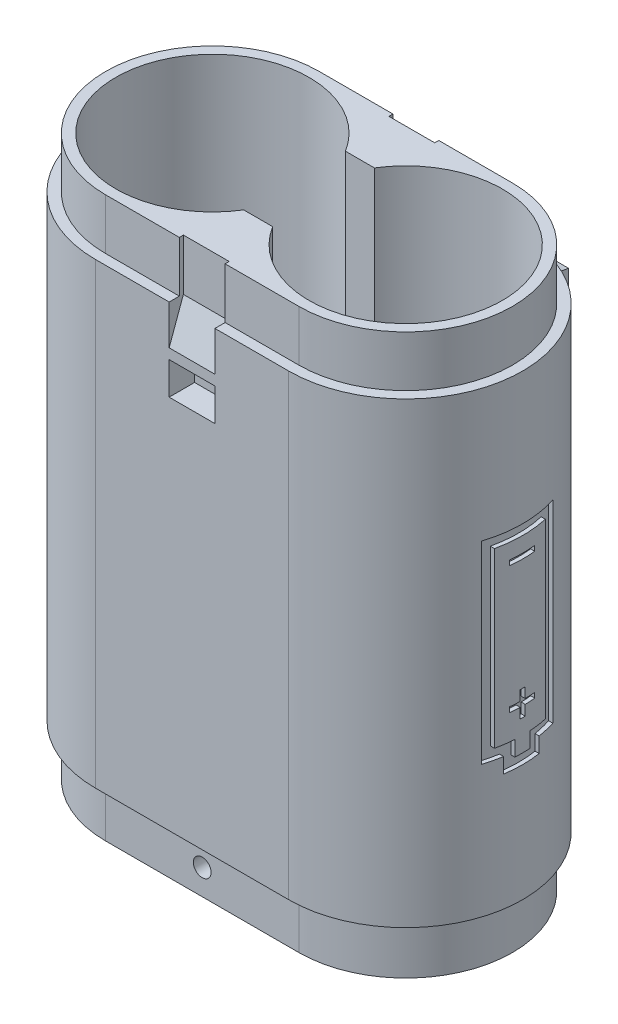
from build123d import *

# Parameters (mm, degrees)
BOSS_EXTRUDE1_DEPTH       = 55
BOSS_EXTRUDE2_START       = -50
BOSS_EXTRUDE2_DEPTH       = 45
SKETCH4_R                 = 0.875
CUT_EXTRUDE2_DEPTH        = 4
CUT_EXTRUDE3_START        = -17
SKETCH4_2_R               = 0.875
CUT_EXTRUDE3_DEPTH        = 4
SKETCH5_W                 = 3
SKETCH5_H                 = 35
BOSS_EXTRUDE3_DEPTH       = 4.5
SKETCH6_W                 = 2
SKETCH6_H                 = 30
CUT_EXTRUDE4_DEPTH        = 65.894144574
FILLET1_R                 = 5
FILLET2_START             = 9.396887596
FILLET2_DEPTH             = 3.103112404
FILLET2_START_2           = 42.5
FILLET2_2_DEPTH           = 3.103112404
FILLET2_START_3           = 5
FILLET2_3_DEPTH           = 4.643212907
FILLET2_START_4           = 45.356787093
FILLET2_4_DEPTH           = 4.643212907
FILLET2_START_5           = 5.025062714
FILLET2_5_DEPTH           = 4.371824882
FILLET2_START_6           = 45.603112404
FILLET2_6_DEPTH           = 4.371824782
FILLET2_START_7           = -12
FILLET2_7_DEPTH           = 24
CUT_EXTRUDE5_REACH        = 73.028
CUT_EXTRUDE5_END_RADIUS   = 11.1
SKETCH7_W                 = 2.5
SKETCH7_H                 = 0.5
CUT_EXTRUDE6_START        = 13.714909815
CUT_EXTRUDE6_DEPTH        = 19
CUT_EXTRUDE6_2_DEPTH      = 1.060507636
CUT_EXTRUDE6_START_2      = 31.775417451
CUT_EXTRUDE6_3_DEPTH      = 2.439492364
CUT_EXTRUDE6_4_DEPTH      = 0.939492364
CUT_EXTRUDE6_START_3      = 33.275417451
CUT_EXTRUDE6_5_DEPTH      = 0.939492364
CUT_EXTRUDE6_START_4      = 16.275417451
CUT_EXTRUDE6_6_DEPTH      = 0.5
CUT_EXTRUDE6_START_5      = 28.775417451
CUT_EXTRUDE6_7_DEPTH      = 0.5
CUT_EXTRUDE6_START_6      = 27.775417451
CUT_EXTRUDE6_8_DEPTH      = 2.5
SKETCH9_W                 = 4.5
SKETCH9_H                 = 3.2
CUT_EXTRUDE7_DEPTH        = 2.5
CUT_EXTRUDE8_START        = -23
SKETCH9_2_W               = 4.5
SKETCH9_2_H               = 3.2
CUT_EXTRUDE8_DEPTH        = 2.5
SKETCH10_W                = 4.5
SKETCH10_H                = 8.9
CUT_EXTRUDE9_DEPTH        = 1.4
CHAMFER1_SIZE2            = 3.846468387
CHAMFER1_SIZE             = 1.4
CHAMFER1_OF_MIRROR1_SIZE2 = 1.4
CHAMFER1_OF_MIRROR1_SIZE  = 3.846468387


with BuildPart() as part:
    # Sketch1 → Boss-Extrude1 (new body)
    with BuildSketch(Plane(origin=(0, 0, 0), x_dir=(1, 0, 0), z_dir=(0, 1, 0))):
        with BuildLine():
            Line((9.5, 10.5), (-9.5, 10.5))
            ThreePointArc((-9.5, 10.5), (-20, 0), (-9.5, -10.5))
            Line((-9.5, -10.5), (9.5, -10.5))
            ThreePointArc((9.5, -10.5), (20, 0), (9.5, 10.5))
        make_face()
        with BuildLine():
            Line((-1.422252789, 5), (1.422252789, 5))
            ThreePointArc((1.422252789, 5), (19, 0), (1.422252789, -5))
            Line((1.422252789, -5), (-1.422252789, -5))
            ThreePointArc((-1.422252789, -5), (-19, 0), (-1.422252789, 5))
        make_face(mode=Mode.SUBTRACT)
    extrude(amount=BOSS_EXTRUDE1_DEPTH)

    # Sketch2 → Boss-Extrude2 (add)
    with BuildSketch(Plane(origin=(0, 55, 0), x_dir=(1, 0, 0), z_dir=(0, 1, 0)).offset(BOSS_EXTRUDE2_START)):
        with BuildLine():
            Line((9.5, 11.5), (-9.5, 11.5))
            ThreePointArc((-9.5, 11.5), (-21, 0), (-9.5, -11.5))
            Line((-9.5, -11.5), (9.5, -11.5))
            ThreePointArc((9.5, -11.5), (21, 0), (9.5, 11.5))
        make_face()
        with BuildLine():
            Line((9.5, 10.5), (-9.5, 10.5))
            ThreePointArc((-9.5, 10.5), (-20, 0), (-9.5, -10.5))
            Line((-9.5, -10.5), (9.5, -10.5))
            ThreePointArc((9.5, -10.5), (20, 0), (9.5, 10.5))
        make_face(mode=Mode.SUBTRACT)
    extrude(amount=BOSS_EXTRUDE2_DEPTH)

    # Sketch4 → Cut-Extrude2 (cut)
    with BuildSketch(Plane(origin=(0, 0, -10.5), x_dir=(-1, 0, 0), z_dir=(0, 0, -1))):
        with Locations((0, 2.5)):
            Circle(SKETCH4_R)
    extrude(amount=-CUT_EXTRUDE2_DEPTH, mode=Mode.SUBTRACT)

    # Sketch4<2> → Cut-Extrude3 (cut)
    with BuildSketch(Plane(origin=(0, 0, -10.5), x_dir=(-1, 0, 0), z_dir=(0, 0, -1)).offset(CUT_EXTRUDE3_START)):
        with Locations((0, 2.5)):
            Circle(SKETCH4_2_R)
    extrude(amount=-CUT_EXTRUDE3_DEPTH, mode=Mode.SUBTRACT)

    # Sketch5 → Boss-Extrude3 (add)
    with BuildSketch(Plane(origin=(0, 0, -11.5), x_dir=(-1, 0, 0), z_dir=(0, 0, -1))):
        with Locations((-8, 27.5)):
            Rectangle(SKETCH5_W, SKETCH5_H)
        with Locations((8, 27.5)):
            Rectangle(SKETCH5_W, SKETCH5_H)
    extrude(amount=BOSS_EXTRUDE3_DEPTH)

    # Sketch6 → Cut-Extrude4 (cut, through all)
    with BuildSketch(Plane(origin=(9.5, 0, 0), x_dir=(0, 0, -1), z_dir=(1, 0, 0))):
        with Locations((12.5, 27.5)):
            Rectangle(SKETCH6_W, SKETCH6_H)
    extrude(amount=-CUT_EXTRUDE4_DEPTH, mode=Mode.SUBTRACT)

    # Fillet1
    # the kernel refuses this fillet: 5 mm, written as the material it adds along each edge
    with BuildSketch(Plane(origin=(9.5, 45, -11.5), x_dir=(0, 1, 0), z_dir=(-1, 0, 0)), Plane(origin=(6.5, 10, -11.5), x_dir=(0, -1, 0), z_dir=(1, 0, 0))) as fillet1_piece_1:
        with BuildLine():
            CenterArc((4.974937186, 5), FILLET1_R, 185.739170477, 84.260829523)
            Line((0, 4.5), (-0.099498744, 4.49))
            ThreePointArc((-0.099498744, 4.49), (-0.1, 2.25), (-0.1, 0))
            Line((-0.1, 0), (0, -0.1))
            Line((0, -0.1), (4.974937186, -0.1))
            Line((4.974937186, -0.1), (4.974937186, 0))
        make_face()
    extrude(amount=3)
    with BuildSketch(Plane(origin=(-9.5, 45, -11.5), x_dir=(0, 1, 0), z_dir=(1, 0, 0)), Plane(origin=(-6.5, 10, -11.5), x_dir=(0, -1, 0), z_dir=(-1, 0, 0))) as fillet1_piece_2:
        with BuildLine():
            CenterArc((4.974937186, -5), FILLET1_R, 90, 84.260829523)
            Line((0, -4.5), (-0.099498744, -4.49))
            ThreePointArc((-0.099498744, -4.49), (-0.1, -2.25), (-0.1, 0))
            Line((-0.1, 0), (0, 0.1))
            Line((0, 0.1), (4.974937186, 0.1))
            Line((4.974937186, 0.1), (4.974937186, 0))
        make_face()
    extrude(amount=3)

    # Fillet2: read off the stored shape, not the designer's step
    # Fillet2 outline → Fillet2 (add)
    with BuildSketch(Plane(origin=(0, 0, 0), x_dir=(1, 0, 0), z_dir=(0, 1, 0)).offset(FILLET2_START)):
        with BuildLine():
            Line((9.5, 13.351029923), (9.5, 11.5))
            ThreePointArc((9.5, 11.5), (10.354211629, 11.46823101), (11.203703704, 11.373099564))
            ThreePointArc((11.203703704, 11.373099564), (9.984646478, 12.045769909), (9.5, 13.351029923))
        make_face()
        with BuildLine():
            ThreePointArc((-11.203703704, 11.373099564), (-10.354211629, 11.46823101), (-9.5, 11.5))
            Line((-9.5, 11.5), (-9.5, 13.351029923))
            ThreePointArc((-9.5, 13.351029923), (-9.984646478, 12.045769909), (-11.203703704, 11.373099564))
        make_face()
    extrude(amount=FILLET2_DEPTH)

    # Fillet2 2 outline → Fillet2 2 (add)
    with BuildSketch(Plane(origin=(0, 0, 0), x_dir=(1, 0, 0), z_dir=(0, 1, 0)).offset(FILLET2_START_2)):
        with BuildLine():
            Line((9.5, 13.351029923), (9.5, 11.5))
            ThreePointArc((9.5, 11.5), (10.354211629, 11.46823101), (11.203703704, 11.373099564))
            ThreePointArc((11.203703704, 11.373099564), (9.984646478, 12.045769909), (9.5, 13.351029923))
        make_face()
        with BuildLine():
            ThreePointArc((-11.203703704, 11.373099564), (-10.354211629, 11.46823101), (-9.5, 11.5))
            Line((-9.5, 11.5), (-9.5, 13.351029923))
            ThreePointArc((-9.5, 13.351029923), (-9.984646478, 12.045769909), (-11.203703704, 11.373099564))
        make_face()
    extrude(amount=FILLET2_2_DEPTH)

    # Fillet2 3 outline → Fillet2 3 (add)
    with BuildSketch(Plane(origin=(0, 0, 0), x_dir=(1, 0, 0), z_dir=(0, 1, 0)).offset(FILLET2_START_3)):
        with BuildLine():
            Line((10.742577908, 11.5), (9.5, 11.5))
            ThreePointArc((9.5, 11.5), (10.354211629, 11.46823101), (11.203703704, 11.373099564))
            ThreePointArc((11.203703704, 11.373099564), (10.969333871, 11.422716292), (10.742577908, 11.5))
        make_face()
        with BuildLine():
            ThreePointArc((-10.742577908, 11.5), (-10.969333871, 11.422716292), (-11.203703704, 11.373099564))
            ThreePointArc((-11.203703704, 11.373099564), (-10.354211629, 11.46823101), (-9.5, 11.5))
            Line((-9.5, 11.5), (-10.742577908, 11.5))
        make_face()
    extrude(amount=FILLET2_3_DEPTH)

    # Fillet2 4 outline → Fillet2 4 (add)
    with BuildSketch(Plane(origin=(0, 0, 0), x_dir=(1, 0, 0), z_dir=(0, 1, 0)).offset(FILLET2_START_4)):
        with BuildLine():
            Line((10.742577908, 11.5), (9.5, 11.5))
            ThreePointArc((9.5, 11.5), (10.354211629, 11.46823101), (11.203703704, 11.373099564))
            ThreePointArc((11.203703704, 11.373099564), (10.969333871, 11.422716292), (10.742577908, 11.5))
        make_face()
        with BuildLine():
            ThreePointArc((-10.742577908, 11.5), (-10.969333871, 11.422716292), (-11.203703704, 11.373099564))
            ThreePointArc((-11.203703704, 11.373099564), (-10.354211629, 11.46823101), (-9.5, 11.5))
            Line((-9.5, 11.5), (-10.742577908, 11.5))
        make_face()
    extrude(amount=FILLET2_4_DEPTH)

    # Fillet2 5 outline → Fillet2 5 (add)
    with BuildSketch(Plane(origin=(0, 0, 0), x_dir=(1, 0, 0), z_dir=(0, 1, 0)).offset(FILLET2_START_5)):
        with BuildLine():
            Line((9.5, 13.351029923), (9.5, 11.5))
            Line((9.5, 11.5), (10.742577908, 11.5))
            ThreePointArc((10.742577908, 11.5), (9.839451268, 12.236320136), (9.5, 13.351029923))
        make_face()
        with BuildLine():
            ThreePointArc((-9.5, 13.351029923), (-9.839451268, 12.236320136), (-10.742577908, 11.5))
            Line((-10.742577908, 11.5), (-9.5, 11.5))
            Line((-9.5, 11.5), (-9.5, 13.351029923))
        make_face()
    extrude(amount=FILLET2_5_DEPTH)

    # Fillet2 6 outline → Fillet2 6 (add)
    with BuildSketch(Plane(origin=(0, 0, 0), x_dir=(1, 0, 0), z_dir=(0, 1, 0)).offset(FILLET2_START_6)):
        with BuildLine():
            Line((9.5, 13.351029923), (9.5, 11.5))
            Line((9.5, 11.5), (10.742577908, 11.5))
            ThreePointArc((10.742577908, 11.5), (9.839451268, 12.236320136), (9.5, 13.351029923))
        make_face()
        with BuildLine():
            ThreePointArc((-9.5, 13.351029923), (-9.839451268, 12.236320136), (-10.742577908, 11.5))
            Line((-10.742577908, 11.5), (-9.5, 11.5))
            Line((-9.5, 11.5), (-9.5, 13.351029923))
        make_face()
    extrude(amount=FILLET2_6_DEPTH)

    # Fillet2 7 outline → Fillet2 7 (cut)
    with BuildSketch(Plane.YZ.offset(FILLET2_START_7)):
        with BuildLine():
            ThreePointArc((49.974937186, -11.5), (47.823757321, -11.986417698), (46.091126241, -13.351029923))
            Line((46.091126241, -13.351029923), (49.974937186, -13.351029923))
            Line((49.974937186, -13.351029923), (49.974937186, -11.5))
        make_face()
        with BuildLine():
            Line((5.025062814, -11.5), (5.025062714, -13.351029923))
            Line((5.025062714, -13.351029923), (8.908873759, -13.351029923))
            ThreePointArc((8.908873759, -13.351029923), (7.176242679, -11.986417698), (5.025062814, -11.5))
        make_face()
    extrude(amount=FILLET2_7_DEPTH, mode=Mode.SUBTRACT)

    # Cut-Extrude5: up to this cylinder (the profile starts outside it)
    cut_extrude5_end = Plane(origin=(9.5, 25.483311, 0), z_dir=(0, 1, 0)) * Cylinder(CUT_EXTRUDE5_END_RADIUS, 186.789378, mode=Mode.PRIVATE)
    # Sketch7 → Cut-Extrude5 (cut, up to the surface)
    with BuildSketch(Plane(origin=(21, 0, 0), x_dir=(0, 0, -1), z_dir=(1, 0, 0)), mode=Mode.PRIVATE) as cut_extrude5_sk1:
        Polygon((-1.75, 16.5), (1.75, 16.5), (1.75, 18), (3.5, 18), (3.5, 37), (-3.5, 37), (-3.5, 18), (-1.75, 18), align=None)
        Polygon((0.75, 19), (2.5, 19), (2.5, 36), (-2.5, 36), (-2.5, 19), (-0.75, 19), (-0.75, 17.5), (0.75, 17.5), align=None, mode=Mode.SUBTRACT)
    cut_extrude5_tool1 = extrude(cut_extrude5_sk1.sketch, amount=-CUT_EXTRUDE5_REACH, mode=Mode.PRIVATE) - cut_extrude5_end
    add(cut_extrude5_tool1.solids().sort_by_distance((21, 16.716622, 0))[0], mode=Mode.SUBTRACT)
    # Sketch7 → Cut-Extrude5 (cut, up to the surface)
    with BuildSketch(Plane(origin=(21, 0, 0), x_dir=(0, 0, -1), z_dir=(1, 0, 0)), mode=Mode.PRIVATE) as cut_extrude5_sk2:
        Polygon((-0.25, 21.5), (-1.25, 21.5), (-1.25, 22), (-0.25, 22), (-0.25, 23), (0.25, 23), (0.25, 22), (1.25, 22), (1.25, 21.5), (0.25, 21.5), (0.25, 20.5), (-0.25, 20.5), align=None)
    cut_extrude5_tool2 = extrude(cut_extrude5_sk2.sketch, amount=-CUT_EXTRUDE5_REACH, mode=Mode.PRIVATE) - cut_extrude5_end
    add(cut_extrude5_tool2.solids().sort_by_distance((21, 21.75, 0))[0], mode=Mode.SUBTRACT)
    # Sketch7 → Cut-Extrude5 (cut, up to the surface)
    with BuildSketch(Plane(origin=(21, 0, 0), x_dir=(0, 0, -1), z_dir=(1, 0, 0)), mode=Mode.PRIVATE) as cut_extrude5_sk3:
        with Locations((0, 34.25)):
            Rectangle(SKETCH7_W, SKETCH7_H)
    cut_extrude5_tool3 = extrude(cut_extrude5_sk3.sketch, amount=-CUT_EXTRUDE5_REACH, mode=Mode.PRIVATE) - cut_extrude5_end
    add(cut_extrude5_tool3.solids().sort_by_distance((21, 34.25, 0))[0], mode=Mode.SUBTRACT)

    # Cut-Extrude6: read off the stored shape, not the designer's step
    # Cut-Extrude6 outline → Cut-Extrude6 (cut)
    with BuildSketch(Plane(origin=(0, 0, 0), x_dir=(1, 0, 0), z_dir=(0, 1, 0)).offset(CUT_EXTRUDE6_START)):
        with BuildLine():
            Line((-20.314804668, -2.5), (-20.72497216, -2.5))
            ThreePointArc((-20.72497216, -2.5), (-20.600977641, -3.003047686), (-20.45445115, -3.5))
            Line((-20.45445115, -3.5), (-20.033755266, -3.5))
            ThreePointArc((-20.033755266, -3.5), (-20.185983942, -3.003289395), (-20.314804668, -2.5))
        make_face()
        with BuildLine():
            ThreePointArc((-20.45445115, 3.5), (-20.600977641, 3.003047686), (-20.72497216, 2.5))
            Line((-20.72497216, 2.5), (-20.314804668, 2.5))
            ThreePointArc((-20.314804668, 2.5), (-20.185983942, 3.003289395), (-20.033755266, 3.5))
            Line((-20.033755266, 3.5), (-20.45445115, 3.5))
        make_face()
    extrude(amount=CUT_EXTRUDE6_DEPTH, mode=Mode.SUBTRACT)

    # Cut-Extrude6 2 outline → Cut-Extrude6 2 (cut)
    with BuildSketch(Plane(origin=(0, 0, 0), x_dir=(1, 0, 0), z_dir=(0, 1, 0)).offset(CUT_EXTRUDE6_START)):
        with BuildLine():
            Line((-20.72497216, -2.5), (-20.314804668, -2.5))
            ThreePointArc((-20.314804668, -2.5), (-20.6, 0), (-20.314804668, 2.5))
            Line((-20.314804668, 2.5), (-20.72497216, 2.5))
            ThreePointArc((-20.72497216, 2.5), (-21, 0), (-20.72497216, -2.5))
        make_face()
    extrude(amount=CUT_EXTRUDE6_2_DEPTH, mode=Mode.SUBTRACT)

    # Cut-Extrude6 3 outline → Cut-Extrude6 3 (cut)
    with BuildSketch(Plane(origin=(0, 0, 0), x_dir=(1, 0, 0), z_dir=(0, 1, 0)).offset(CUT_EXTRUDE6_START_2)):
        with BuildLine():
            Line((-20.866067922, -1.75), (-20.461181506, -1.75))
            ThreePointArc((-20.461181506, -1.75), (-20.529246673, -1.251286466), (-20.574633177, -0.75))
            Line((-20.574633177, -0.75), (-20.975517418, -0.75))
            ThreePointArc((-20.975517418, -0.75), (-20.93173238, -1.251197346), (-20.866067922, -1.75))
        make_face()
        with BuildLine():
            Line((-20.975517418, 0.75), (-20.574633177, 0.75))
            ThreePointArc((-20.574633177, 0.75), (-20.529246673, 1.251286466), (-20.461181506, 1.75))
            Line((-20.461181506, 1.75), (-20.866067922, 1.75))
            ThreePointArc((-20.866067922, 1.75), (-20.93173238, 1.251197346), (-20.975517418, 0.75))
        make_face()
    extrude(amount=CUT_EXTRUDE6_3_DEPTH, mode=Mode.SUBTRACT)

    # Cut-Extrude6 4 outline → Cut-Extrude6 4 (cut)
    with BuildSketch(Plane(origin=(0, 0, 0), x_dir=(1, 0, 0), z_dir=(0, 1, 0)).offset(CUT_EXTRUDE6_START_2)):
        with BuildLine():
            Line((-20.461181506, -1.75), (-20.866067922, -1.75))
            ThreePointArc((-20.866067922, -1.75), (-20.80174314, -2.126170737), (-20.72497216, -2.5))
            Line((-20.72497216, -2.5), (-20.314804668, -2.5))
            ThreePointArc((-20.314804668, -2.5), (-20.394448974, -2.12625999), (-20.461181506, -1.75))
        make_face()
        with BuildLine():
            ThreePointArc((-20.72497216, 2.5), (-20.80174314, 2.126170737), (-20.866067922, 1.75))
            Line((-20.866067922, 1.75), (-20.461181506, 1.75))
            ThreePointArc((-20.461181506, 1.75), (-20.394448974, 2.12625999), (-20.314804668, 2.5))
            Line((-20.314804668, 2.5), (-20.72497216, 2.5))
        make_face()
    extrude(amount=CUT_EXTRUDE6_4_DEPTH, mode=Mode.SUBTRACT)

    # Cut-Extrude6 5 outline → Cut-Extrude6 5 (cut)
    with BuildSketch(Plane(origin=(0, 0, 0), x_dir=(1, 0, 0), z_dir=(0, 1, 0)).offset(CUT_EXTRUDE6_START_3)):
        with BuildLine():
            Line((-20.975517418, -0.75), (-20.574633177, -0.75))
            ThreePointArc((-20.574633177, -0.75), (-20.6, 0), (-20.574633177, 0.75))
            Line((-20.574633177, 0.75), (-20.975517418, 0.75))
            ThreePointArc((-20.975517418, 0.75), (-21, 0), (-20.975517418, -0.75))
        make_face()
    extrude(amount=CUT_EXTRUDE6_5_DEPTH, mode=Mode.SUBTRACT)

    # Cut-Extrude6 6 outline → Cut-Extrude6 6 (cut)
    with BuildSketch(Plane(origin=(0, 0, 0), x_dir=(1, 0, 0), z_dir=(0, 1, 0)).offset(CUT_EXTRUDE6_START_4)):
        with BuildLine():
            Line((-20.914098741, -1.402978946), (-20.510978616, -1.402978946))
            ThreePointArc((-20.510978616, -1.402978946), (-20.598932236, -0.15395847), (-20.545657283, 1.097021054))
            Line((-20.545657283, 1.097021054), (-20.947556281, 1.097021054))
            ThreePointArc((-20.947556281, 1.097021054), (-20.998970284, -0.153890902), (-20.914098741, -1.402978946))
        make_face()
    extrude(amount=CUT_EXTRUDE6_6_DEPTH, mode=Mode.SUBTRACT)

    # Cut-Extrude6 7 outline → Cut-Extrude6 7 (cut)
    with BuildSketch(Plane(origin=(0, 0, 0), x_dir=(1, 0, 0), z_dir=(0, 1, 0)).offset(CUT_EXTRUDE6_START_5)):
        with BuildLine():
            Line((-20.914098741, -1.402978946), (-20.510978616, -1.402978946))
            ThreePointArc((-20.510978616, -1.402978946), (-20.598932236, -0.15395847), (-20.545657283, 1.097021054))
            Line((-20.545657283, 1.097021054), (-20.947556281, 1.097021054))
            ThreePointArc((-20.947556281, 1.097021054), (-20.998970284, -0.153890902), (-20.914098741, -1.402978946))
        make_face()
    extrude(amount=CUT_EXTRUDE6_7_DEPTH, mode=Mode.SUBTRACT)

    # Cut-Extrude6 8 outline → Cut-Extrude6 8 (cut)
    with BuildSketch(Plane(origin=(0, 0, 0), x_dir=(1, 0, 0), z_dir=(0, 1, 0)).offset(CUT_EXTRUDE6_START_6)):
        with BuildLine():
            ThreePointArc((-20.999590728, 0.097021054), (-20.998981971, -0.153015113), (-20.992937308, -0.402978946))
            Line((-20.992937308, -0.402978946), (-20.592682632, -0.402978946))
            ThreePointArc((-20.592682632, -0.402978946), (-20.598945245, -0.153017769), (-20.599575979, 0.097021054))
            Line((-20.599575979, 0.097021054), (-20.999590728, 0.097021054))
        make_face()
    extrude(amount=CUT_EXTRUDE6_8_DEPTH, mode=Mode.SUBTRACT)

    # Sketch9 → Cut-Extrude7 (cut)
    with BuildSketch(Plane.XY.offset(11.5)):
        with Locations((0, 43.5)):
            Rectangle(SKETCH9_W, SKETCH9_H)
    extrude(amount=-CUT_EXTRUDE7_DEPTH, mode=Mode.SUBTRACT)

    # Sketch9<2> → Cut-Extrude8 (cut)
    with BuildSketch(Plane.XY.offset(11.5).offset(CUT_EXTRUDE8_START)):
        with Locations((0, 43.5)):
            Rectangle(SKETCH9_2_W, SKETCH9_2_H)
    extrude(amount=CUT_EXTRUDE8_DEPTH, mode=Mode.SUBTRACT)

    # Sketch10 → Cut-Extrude9 (cut)
    with BuildSketch(Plane(origin=(0, 0, -11.5), x_dir=(-1, 0, 0), z_dir=(0, 0, -1))):
        with Locations((0, 50.55)):
            Rectangle(SKETCH10_W, SKETCH10_H)
    cut_extrude9 = extrude(amount=-CUT_EXTRUDE9_DEPTH, mode=Mode.SUBTRACT)

    # Chamfer1
    chamfer1_edges = [part.edges().sort_by_distance(p)[0] for p in [
        (0, 46.1, -10.1),
    ]]
    chamfer1_side = [part.faces().sort_by_distance(p)[0] for p in [
        (0, 46.1, -10.128),
    ]]
    chamfer(chamfer1_edges, length=CHAMFER1_SIZE - 0.0001, length2=CHAMFER1_SIZE2 - 0.0001, reference=chamfer1_side[0])  # a hair under: the kernel refuses the full size

    # Mirror1: Cut-Extrude9 across plane
    add(cut_extrude9.mirror(Plane.XY), mode=Mode.SUBTRACT)

    # Chamfer1 of Mirror1
    chamfer1_of_mirror1_edges = [part.edges().sort_by_distance(p)[0] for p in [
        (0, 46.1, 10.1),
    ]]
    chamfer1_of_mirror1_side = [part.faces().sort_by_distance(p)[0] for p in [
        (0, 46.128, 10.1),
    ]]
    chamfer(chamfer1_of_mirror1_edges, length=CHAMFER1_OF_MIRROR1_SIZE - 0.0001, length2=CHAMFER1_OF_MIRROR1_SIZE2 - 0.0001, reference=chamfer1_of_mirror1_side[0])  # a hair under: the kernel refuses the full size


solid = part.part
